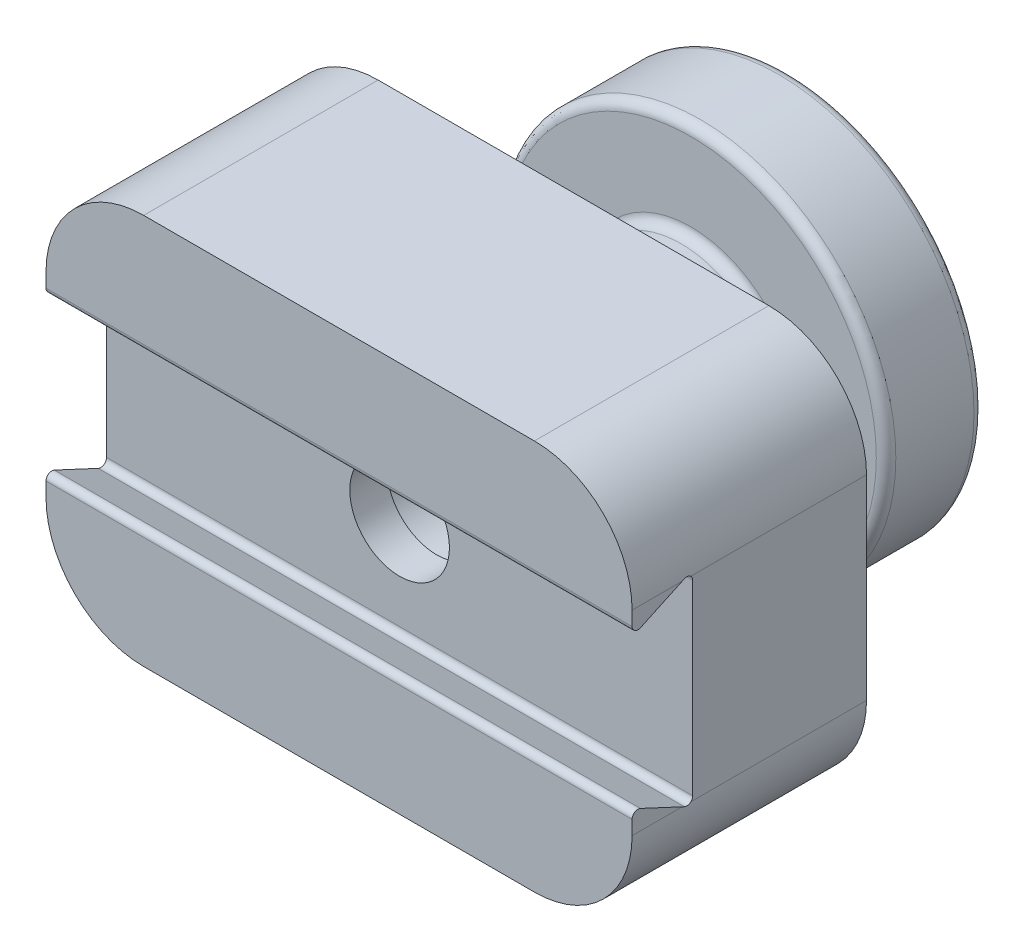
from build123d import *

# Parameters (mm, degrees)
BOSS_EXTRUDE1_DEPTH     = 5
SKETCH2_R               = 5
BOSS_EXTRUDE2_DEPTH     = 11
SKETCH3_W               = 30
SKETCH3_H               = 20
BOSS_EXTRUDE3_DEPTH     = 12
CUT_EXTRUDE1_DEPTH      = 36.411862419
CUT_EXTRUDE1_DEPTH_BACK = 36.411862419
SKETCH6_R               = 2.55
CUT_EXTRUDE2_DEPTH      = 5
FILLET1_R               = 0.3
FILLET2_R               = 5
FILLET3_R               = 0.5
SKETCH7_R               = 2.9
CUT_EXTRUDE3_DEPTH      = 6


with BuildPart() as part:
    # Sketch1 → Boss-Extrude1 (new body)
    with BuildSketch(Plane.XY):
        with BuildLine():
            ThreePointArc((10, 0), (0, 10), (-10, 0))
            ThreePointArc((-10, 0), (0, -10), (10, 0))
        make_face()
    extrude(amount=BOSS_EXTRUDE1_DEPTH)

    # Sketch2 → Boss-Extrude2 (add)
    with BuildSketch(Plane.XY):
        Circle(SKETCH2_R)
    extrude(amount=BOSS_EXTRUDE2_DEPTH)

    # Sketch3 → Boss-Extrude3 (add)
    with BuildSketch(Plane.XY.offset(11)):
        Rectangle(SKETCH3_W, SKETCH3_H)
    extrude(amount=BOSS_EXTRUDE3_DEPTH)

    # Sketch5 → Cut-Extrude1 (cut, two sides: drawn at the far end of the back side and taken through both)
    with BuildSketch(Plane(origin=(-10, 0, 0), x_dir=(0, 0, -1), z_dir=(1, 0, 0)).offset(-CUT_EXTRUDE1_DEPTH_BACK)):
        Polygon((-23, 3.80444626), (-19.9, 5.25), (-19.9, -5.25), (-23, -3.80444626), align=None)
    extrude(amount=CUT_EXTRUDE1_DEPTH + CUT_EXTRUDE1_DEPTH_BACK, mode=Mode.SUBTRACT)

    # Sketch6 → Cut-Extrude2 (cut)
    with BuildSketch(Plane.XY.offset(23)):
        Circle(SKETCH6_R)
    extrude(amount=-CUT_EXTRUDE2_DEPTH, mode=Mode.SUBTRACT)

    # Fillet1
    fillet1_edges = [part.edges().sort_by_distance(p)[0] for p in [
        (0, -5.25, 19.9),
        (0, -3.80444626, 23),
        (0, 5.25, 19.9),
        (0, 3.80444626, 23),
    ]]
    fillet(fillet1_edges, radius=FILLET1_R)

    # Fillet2
    fillet2_edges = [part.edges().sort_by_distance(p)[0] for p in [
        (-15, -10, 17),
        (15, -10, 17),
        (15, 10, 17),
        (-15, 10, 17),
    ]]
    fillet(fillet2_edges, radius=FILLET2_R)

    # Fillet3
    fillet3_edges = [part.edges().sort_by_distance(p)[0] for p in [
        (10, 0, 0),
        (10, 0, 5),
        (-5, 0, 5),
        (-5, 0, 11),
    ]]
    fillet(fillet3_edges, radius=FILLET3_R)

    # Sketch7 → Cut-Extrude3 (cut)
    with BuildSketch(Plane.XY.offset(18)):
        Circle(SKETCH7_R)
    extrude(amount=-CUT_EXTRUDE3_DEPTH, mode=Mode.SUBTRACT)


solid = part.part
